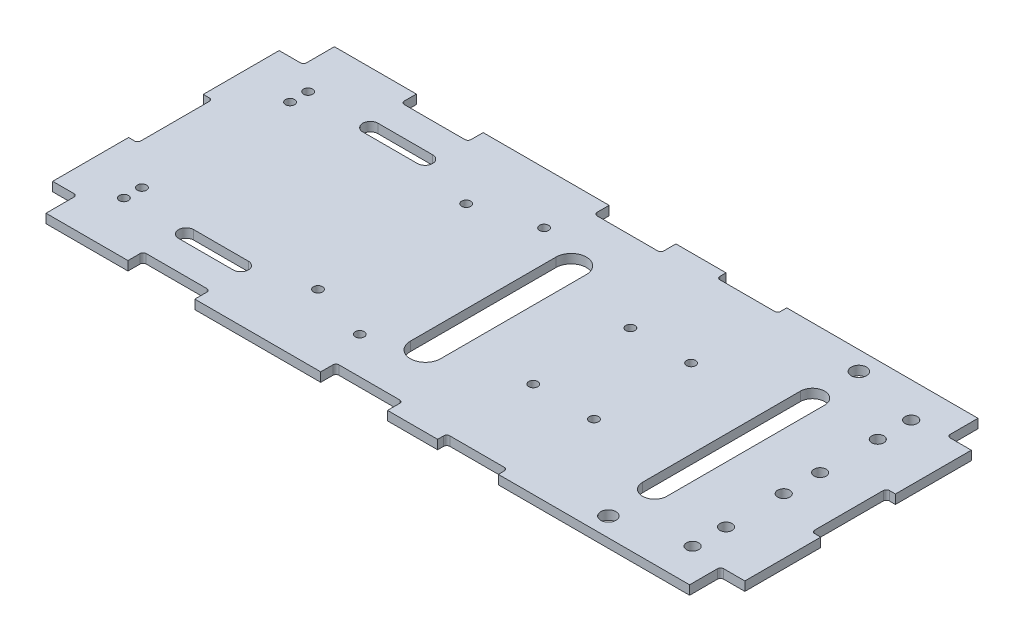
from build123d import *

# Parameters (mm, degrees)
SKETCH_4_W           = 228
SKETCH_4_H           = 95
EXTRUDE_3_DEPTH      = 3
SKETCH_5_W           = 3
SKETCH_5_H           = 12.3
CUT_EXTRUDE_1_DEPTH  = 124.536431873
SKETCH_6_W           = 8
SKETCH_6_H           = 10.2
CUT_EXTRUDE_2_DEPTH  = 124.536431873
FILLET_2_R           = 1
FILLET_5_R           = 1
SKETCH_7_W           = 3
SKETCH_7_H           = 12.3
CUT_EXTRUDE_3_DEPTH  = 124.536431873
FILLET_6_R           = 1
SKETCH_8_W           = 8
SKETCH_8_H           = 10.2
CUT_EXTRUDE_5_DEPTH  = 124.536431873
FILLET_9_R           = 1
SKETCH_10_W          = 3
SKETCH_10_H          = 12.3
CUT_EXTRUDE_6_DEPTH  = 124.536431873
SKETCH_11_W          = 3
SKETCH_11_H          = 12.3
CUT_EXTRUDE_7_DEPTH  = 124.536431873
SKETCH_12_W          = 8
SKETCH_12_H          = 10.2
CUT_EXTRUDE_8_DEPTH  = 124.536431873
SKETCH_13_W          = 8
SKETCH_13_H          = 10.2
CUT_EXTRUDE_10_DEPTH = 124.536431873
FILLET_13_R          = 1
FILLET_15_R          = 1
FILLET_18_R          = 1
FILLET_19_R          = 1
SKETCH_14_R          = 1.5
SKETCH_14_R_2        = 2
SKETCH_14_R_3        = 2.5
SKETCH_14_W          = 22
SKETCH_14_H          = 10
SKETCH_14_W_2        = 20
SKETCH_14_H_2        = 6
CUT_EXTRUDE_11_DEPTH = 124.536431873
FILLET_20_R          = 1
FILLET_21_R          = 1
FILLET_22_R          = 1
FILLET_23_R          = 1
FILLET_24_R          = 1
FILLET_25_R          = 1
FILLET_26_R          = 1
FILLET_27_R          = 1
FILLET_28_R          = 1
FILLET_29_R          = 1
FILLET_30_R          = 1
FILLET_31_R          = 1


with BuildPart() as part:
    # 草图4 → 凸台-拉伸3 (new body)
    with BuildSketch(Plane(origin=(0, 0, 0), x_dir=(1, 0, 0), z_dir=(0, 1, 0))):
        Rectangle(SKETCH_4_W, SKETCH_4_H)
    extrude(amount=EXTRUDE_3_DEPTH)

    # 草图5 → 切除-拉伸1 (cut, through all)
    with BuildSketch(Plane(origin=(0, 3, 0), x_dir=(1, 0, 0), z_dir=(0, 1, 0))):
        with Locations((-112.5, 6.15)):
            Rectangle(SKETCH_5_W, SKETCH_5_H)
    extrude(amount=-CUT_EXTRUDE_1_DEPTH, mode=Mode.SUBTRACT)

    # 草图6 → 切除-拉伸2 (cut, through all)
    with BuildSketch(Plane(origin=(0, 3, 0), x_dir=(1, 0, 0), z_dir=(0, 1, 0))):
        with Locations((-110, 42.4)):
            Rectangle(SKETCH_6_W, SKETCH_6_H)
    extrude(amount=-CUT_EXTRUDE_2_DEPTH, mode=Mode.SUBTRACT)

    # 圆角2
    fillet_2_edges = [part.edges().sort_by_distance(p)[0] for p in [
        (-106, 1.5, -37.3),
    ]]
    fillet(fillet_2_edges, radius=FILLET_2_R)

    # 圆角5
    fillet_5_edges = [part.edges().sort_by_distance(p)[0] for p in [
        (-111, 1.5, -12.3),
    ]]
    fillet(fillet_5_edges, radius=FILLET_5_R)

    # 草图7 → 切除-拉伸3 (cut, through all)
    with BuildSketch(Plane(origin=(0, 3, 0), x_dir=(1, 0, 0), z_dir=(0, 1, 0))):
        with Locations((-112.5, -6.15)):
            Rectangle(SKETCH_7_W, SKETCH_7_H)
    extrude(amount=-CUT_EXTRUDE_3_DEPTH, mode=Mode.SUBTRACT)

    # 圆角6
    fillet_6_edges = [part.edges().sort_by_distance(p)[0] for p in [
        (-111, 1.5, 12.3),
    ]]
    fillet(fillet_6_edges, radius=FILLET_6_R)

    # 草图8 → 切除-拉伸5 (cut, through all)
    with BuildSketch(Plane(origin=(0, 3, 0), x_dir=(1, 0, 0), z_dir=(0, 1, 0))):
        with Locations((-110, -42.4)):
            Rectangle(SKETCH_8_W, SKETCH_8_H)
    extrude(amount=-CUT_EXTRUDE_5_DEPTH, mode=Mode.SUBTRACT)

    # 圆角9
    fillet_9_edges = [part.edges().sort_by_distance(p)[0] for p in [
        (-106, 1.5, 37.3),
    ]]
    fillet(fillet_9_edges, radius=FILLET_9_R)

    # 草图10 → 切除-拉伸6 (cut, through all)
    with BuildSketch(Plane(origin=(0, 3, 0), x_dir=(1, 0, 0), z_dir=(0, 1, 0))):
        with Locations((112.5, 6.15)):
            Rectangle(SKETCH_10_W, SKETCH_10_H)
    extrude(amount=-CUT_EXTRUDE_6_DEPTH, mode=Mode.SUBTRACT)

    # 草图11 → 切除-拉伸7 (cut, through all)
    with BuildSketch(Plane(origin=(0, 3, 0), x_dir=(1, 0, 0), z_dir=(0, 1, 0))):
        with Locations((112.5, -6.15)):
            Rectangle(SKETCH_11_W, SKETCH_11_H)
    extrude(amount=-CUT_EXTRUDE_7_DEPTH, mode=Mode.SUBTRACT)

    # 草图12 → 切除-拉伸8 (cut, through all)
    with BuildSketch(Plane(origin=(0, 3, 0), x_dir=(1, 0, 0), z_dir=(0, 1, 0))):
        with Locations((110, 42.4)):
            Rectangle(SKETCH_12_W, SKETCH_12_H)
    extrude(amount=-CUT_EXTRUDE_8_DEPTH, mode=Mode.SUBTRACT)

    # 草图13 → 切除-拉伸10 (cut, through all)
    with BuildSketch(Plane(origin=(0, 3, 0), x_dir=(1, 0, 0), z_dir=(0, 1, 0))):
        with Locations((110, -42.4)):
            Rectangle(SKETCH_13_W, SKETCH_13_H)
    extrude(amount=-CUT_EXTRUDE_10_DEPTH, mode=Mode.SUBTRACT)

    # 圆角13
    fillet_13_edges = [part.edges().sort_by_distance(p)[0] for p in [
        (106, 1.5, -37.3),
    ]]
    fillet(fillet_13_edges, radius=FILLET_13_R)

    # 圆角15
    fillet_15_edges = [part.edges().sort_by_distance(p)[0] for p in [
        (106, 1.5, 37.3),
    ]]
    fillet(fillet_15_edges, radius=FILLET_15_R)

    # 圆角18
    fillet_18_edges = [part.edges().sort_by_distance(p)[0] for p in [
        (111, 1.5, 12.3),
    ]]
    fillet(fillet_18_edges, radius=FILLET_18_R)

    # 圆角19
    fillet_19_edges = [part.edges().sort_by_distance(p)[0] for p in [
        (111, 1.5, -12.3),
    ]]
    fillet(fillet_19_edges, radius=FILLET_19_R)

    # 草图14 → 切除-拉伸11 (cut, through all)
    with BuildSketch(Plane(origin=(0, 3, 0), x_dir=(1, 0, 0), z_dir=(0, 1, 0))):
        with Locations((-97.5, 30.35)):
            Circle(SKETCH_14_R)
        with Locations((-19.78, 30.35)):
            Circle(SKETCH_14_R)
        with Locations((-97.5, 24.4)):
            Circle(SKETCH_14_R)
        with Locations((-39.5, 24.4)):
            Circle(SKETCH_14_R)
        with Locations((95.5, 6)):
            Circle(SKETCH_14_R_2)
        with Locations((95.5, 25)):
            Circle(SKETCH_14_R_2)
        with Locations((95.5, 36)):
            Circle(SKETCH_14_R_2)
        with Locations((73, 41.25)):
            Circle(SKETCH_14_R_3)
        with Locations((43, 16)):
            Circle(SKETCH_14_R)
        with Locations((23, 16)):
            Circle(SKETCH_14_R)
        with Locations((95.5, -6)):
            Circle(SKETCH_14_R_2)
        with Locations((95.5, -25)):
            Circle(SKETCH_14_R_2)
        with Locations((95.5, -36)):
            Circle(SKETCH_14_R_2)
        with Locations((73, -41.25)):
            Circle(SKETCH_14_R_3)
        with Locations((43, -16)):
            Circle(SKETCH_14_R)
        with Locations((23, -16)):
            Circle(SKETCH_14_R)
        with Locations((-19.78, -30.35)):
            Circle(SKETCH_14_R)
        with Locations((-39.5, -24.4)):
            Circle(SKETCH_14_R)
        with Locations((-97.5, -24.4)):
            Circle(SKETCH_14_R)
        with Locations((-97.5, -30.35)):
            Circle(SKETCH_14_R)
        with BuildLine():
            Line((0.5, 24), (0.5, -24))
            ThreePointArc((0.5, -24), (-4.5, -29), (-9.5, -24))
            Line((-9.5, -24), (-9.5, 24))
            ThreePointArc((-9.5, 24), (-4.5, 29), (0.5, 24))
        make_face()
        with BuildLine():
            Line((77, 26), (77, -26))
            ThreePointArc((77, -26), (73, -30), (69, -26))
            Line((69, -26), (69, 26))
            ThreePointArc((69, 26), (73, 30), (77, 26))
        make_face()
        with BuildLine():
            Line((-76.995993088, 32.85), (-58.995993088, 32.85))
            ThreePointArc((-58.995993088, 32.85), (-56.495993088, 30.35), (-58.995993088, 27.85))
            Line((-58.995993088, 27.85), (-76.995993088, 27.85))
            ThreePointArc((-76.995993088, 27.85), (-79.495993088, 30.35), (-76.995993088, 32.85))
        make_face()
        with Locations((-67.995993088, 47.5)):
            Rectangle(SKETCH_14_W, SKETCH_14_H)
        with Locations((33, -47.5)):
            Rectangle(SKETCH_14_W_2, SKETCH_14_H_2)
        with Locations((-4.5, 47.5)):
            Rectangle(SKETCH_14_W, SKETCH_14_H)
        with Locations((33, 47.5)):
            Rectangle(SKETCH_14_W_2, SKETCH_14_H_2)
        with BuildLine():
            Line((-76.995993088, -32.85), (-58.995993088, -32.85))
            ThreePointArc((-58.995993088, -32.85), (-56.495993088, -30.35), (-58.995993088, -27.85))
            Line((-58.995993088, -27.85), (-76.995993088, -27.85))
            ThreePointArc((-76.995993088, -27.85), (-79.495993088, -30.35), (-76.995993088, -32.85))
        make_face()
        with Locations((-4.5, -47.5)):
            Rectangle(SKETCH_14_W, SKETCH_14_H)
        with Locations((-67.995993088, -47.5)):
            Rectangle(SKETCH_14_W, SKETCH_14_H)
    extrude(amount=-CUT_EXTRUDE_11_DEPTH, mode=Mode.SUBTRACT)

    # 圆角20
    fillet_20_edges = [part.edges().sort_by_distance(p)[0] for p in [
        (-78.995993088, 1.5, -42.5),
    ]]
    fillet(fillet_20_edges, radius=FILLET_20_R)

    # 圆角21
    fillet_21_edges = [part.edges().sort_by_distance(p)[0] for p in [
        (-56.995993088, 1.5, -42.5),
    ]]
    fillet(fillet_21_edges, radius=FILLET_21_R)

    # 圆角22
    fillet_22_edges = [part.edges().sort_by_distance(p)[0] for p in [
        (-15.5, 1.5, -42.5),
    ]]
    fillet(fillet_22_edges, radius=FILLET_22_R)

    # 圆角23
    fillet_23_edges = [part.edges().sort_by_distance(p)[0] for p in [
        (6.5, 1.5, -42.5),
    ]]
    fillet(fillet_23_edges, radius=FILLET_23_R)

    # 圆角24
    fillet_24_edges = [part.edges().sort_by_distance(p)[0] for p in [
        (23, 1.5, -44.5),
    ]]
    fillet(fillet_24_edges, radius=FILLET_24_R)

    # 圆角25
    fillet_25_edges = [part.edges().sort_by_distance(p)[0] for p in [
        (43, 1.5, -44.5),
    ]]
    fillet(fillet_25_edges, radius=FILLET_25_R)

    # 圆角26
    fillet_26_edges = [part.edges().sort_by_distance(p)[0] for p in [
        (-78.995993088, 1.5, 42.5),
    ]]
    fillet(fillet_26_edges, radius=FILLET_26_R)

    # 圆角27
    fillet_27_edges = [part.edges().sort_by_distance(p)[0] for p in [
        (-56.995993088, 1.5, 42.5),
    ]]
    fillet(fillet_27_edges, radius=FILLET_27_R)

    # 圆角28
    fillet_28_edges = [part.edges().sort_by_distance(p)[0] for p in [
        (-15.5, 1.5, 42.5),
    ]]
    fillet(fillet_28_edges, radius=FILLET_28_R)

    # 圆角29
    fillet_29_edges = [part.edges().sort_by_distance(p)[0] for p in [
        (6.5, 1.5, 42.5),
    ]]
    fillet(fillet_29_edges, radius=FILLET_29_R)

    # 圆角30
    fillet_30_edges = [part.edges().sort_by_distance(p)[0] for p in [
        (23, 1.5, 44.5),
    ]]
    fillet(fillet_30_edges, radius=FILLET_30_R)

    # 圆角31
    fillet_31_edges = [part.edges().sort_by_distance(p)[0] for p in [
        (43, 1.5, 44.5),
    ]]
    fillet(fillet_31_edges, radius=FILLET_31_R)


solid = part.part
